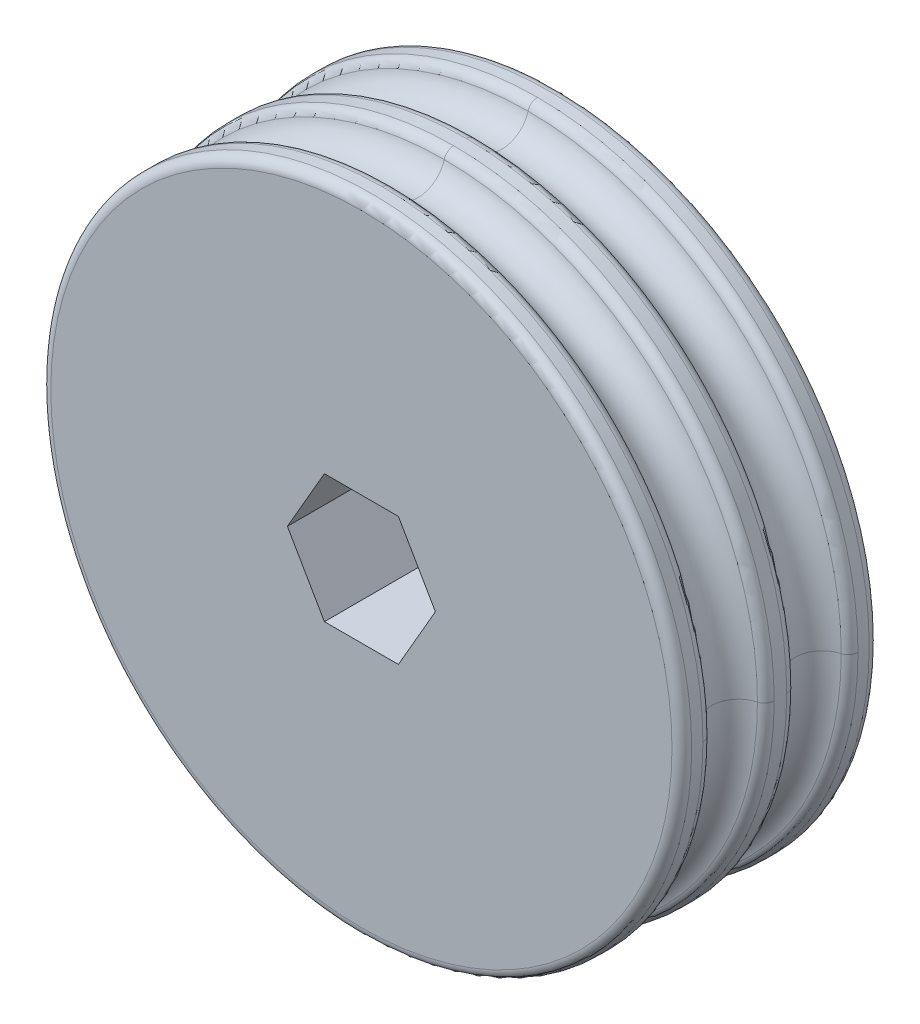
from build123d import *

# Parameters (mm, degrees)
SKETCH1_R           = 32.5
BOSS_EXTRUDE1_DEPTH = 10
FILLET1_R           = 1


with BuildPart() as part:
    # Sketch1 → Boss-Extrude1 (new, symmetric)
    with BuildSketch(Plane.XY):
        Circle(SKETCH1_R)
        Polygon((3.75277675, -6.5), (7.505553499, 0), (3.75277675, 6.5), (-3.75277675, 6.5), (-7.505553499, 0), (-3.75277675, -6.5), align=None, mode=Mode.SUBTRACT)
    extrude(amount=BOSS_EXTRUDE1_DEPTH, both=True)

    # Cut-Sweep1: sweep along a curve in space
    with BuildLine() as cut_sweep1_path:
        ThreePointArc((32.5, 0, -10), (22.980970389, 22.980970389, -10), (0, 32.5, -10))
        ThreePointArc((0, 32.5, -10), (-22.980970389, 22.980970389, -10), (-32.5, 0, -10))
        ThreePointArc((-32.5, 0, -10), (-22.980970389, -22.980970389, -10), (0, -32.5, -10))
        ThreePointArc((0, -32.5, -10), (22.980970389, -22.980970389, -10), (32.5, 0, -10))
    # Sketch2 → Cut-Sweep1 (sweep, cut)
    with BuildSketch(Plane(origin=(0, 0, 0), x_dir=(0, 0, -1), z_dir=(1, 0, 0))):
        with BuildLine():
            Line((7, 32.5), (1.5, 32.5))
            ThreePointArc((1.5, 32.5), (4.25, 29.75), (7, 32.5))
        make_face()
    cut_sweep1 = sweep(path=cut_sweep1_path.line, mode=Mode.SUBTRACT)

    # Mirror1: Cut-Sweep1 across plane
    add(cut_sweep1.mirror(Plane.XY), mode=Mode.SUBTRACT)

    # Fillet1
    fillet1_edges = [part.edges().sort_by_distance(p)[0] for p in [
        (22.980970389, 22.980970389, 7),
        (-22.980970389, -22.980970389, 7),
        (22.980970389, 22.980970389, -7),
        (-22.980970389, -22.980970389, -7),
        (22.980970389, 22.980970389, -1.5),
        (-22.980970389, -22.980970389, -1.5),
        (-32.5, 0, 10),
        (-32.5, 0, -10),
        (22.980970389, 22.980970389, 1.5),
        (-22.980970389, -22.980970389, 1.5),
    ]]
    fillet(fillet1_edges, radius=FILLET1_R)


solid = part.part
